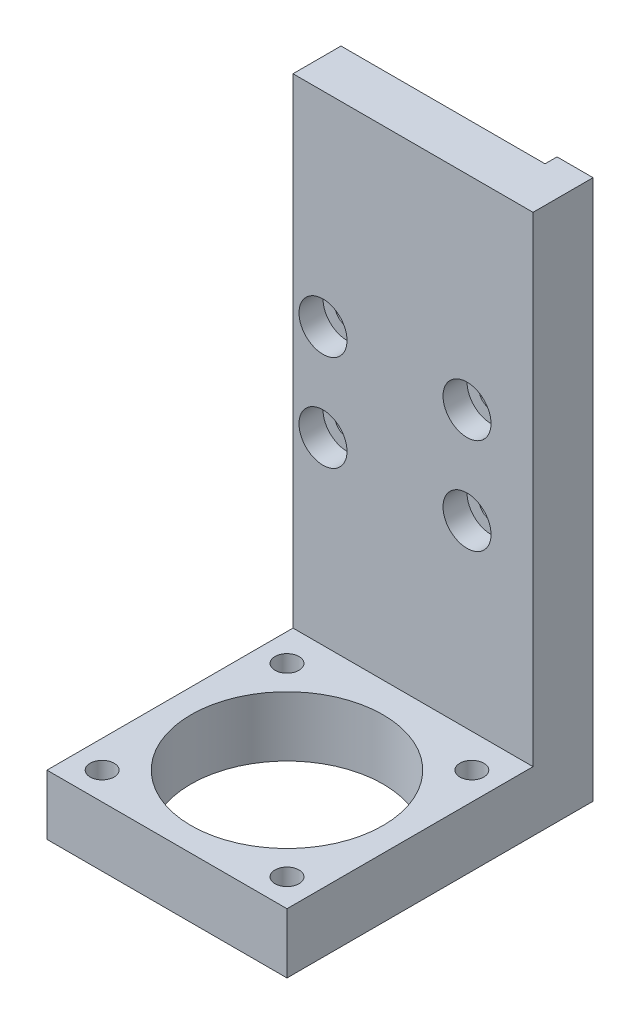
from build123d import *

# Parameters (mm, degrees)
BOSS_EXTRUDE1_DEPTH = 20
SKETCH3_R           = 8
SKETCH3_R_2         = 1
CUT_EXTRUDE1_DEPTH  = 10
SKETCH4_R           = 1
CUT_EXTRUDE2_DEPTH  = 10
SKETCH5_R           = 2
CUT_EXTRUDE3_DEPTH  = 2
SKETCH6_W           = 17
SKETCH6_H           = 1
CUT_EXTRUDE4_DEPTH  = 65


with BuildPart() as part:
    # Sketch1 → Boss-Extrude1 (new body)
    with BuildSketch(Plane(origin=(0, 0, 0), x_dir=(0, 0, -1), z_dir=(1, 0, 0))):
        Polygon((0, 0), (20.5, 0), (20.5, 40), (25.5, 40), (25.5, -5), (0, -5), align=None)
    extrude(amount=BOSS_EXTRUDE1_DEPTH)

    # Sketch3 → Cut-Extrude1 (cut)
    with BuildSketch(Plane(origin=(0, 0, 0), x_dir=(1, 0, 0), z_dir=(0, 1, 0))):
        with Locations((10, 10)):
            Circle(SKETCH3_R)
        with Locations((2.3, 17.7)):
            Circle(SKETCH3_R_2)
        with Locations((17.7, 17.7)):
            Circle(SKETCH3_R_2)
        with Locations((17.7, 2.3)):
            Circle(SKETCH3_R_2)
        with Locations((2.3, 2.3)):
            Circle(SKETCH3_R_2)
    extrude(amount=-CUT_EXTRUDE1_DEPTH, mode=Mode.SUBTRACT)

    # Sketch4 → Cut-Extrude2 (cut)
    with BuildSketch(Plane.XY.offset(-20.5)):
        with Locations((2.5, 15)):
            Circle(SKETCH4_R)
        with Locations((2.5, 23)):
            Circle(SKETCH4_R)
        with Locations((14.5, 23)):
            Circle(SKETCH4_R)
        with Locations((14.5, 15)):
            Circle(SKETCH4_R)
    extrude(amount=-CUT_EXTRUDE2_DEPTH, mode=Mode.SUBTRACT)

    # Sketch5 → Cut-Extrude3 (cut)
    with BuildSketch(Plane.XY.offset(-20.5)):
        with Locations((2.5, 23)):
            Circle(SKETCH5_R)
        with Locations((2.5, 15)):
            Circle(SKETCH5_R)
        with Locations((14.5, 15)):
            Circle(SKETCH5_R)
        with Locations((14.5, 23)):
            Circle(SKETCH5_R)
    extrude(amount=-CUT_EXTRUDE3_DEPTH, mode=Mode.SUBTRACT)

    # Sketch6 → Cut-Extrude4 (cut)
    with BuildSketch(Plane(origin=(0, 40, 0), x_dir=(1, 0, 0), z_dir=(0, 1, 0))):
        with Locations((8.5, 25)):
            Rectangle(SKETCH6_W, SKETCH6_H)
    extrude(amount=-CUT_EXTRUDE4_DEPTH, mode=Mode.SUBTRACT)


solid = part.part
